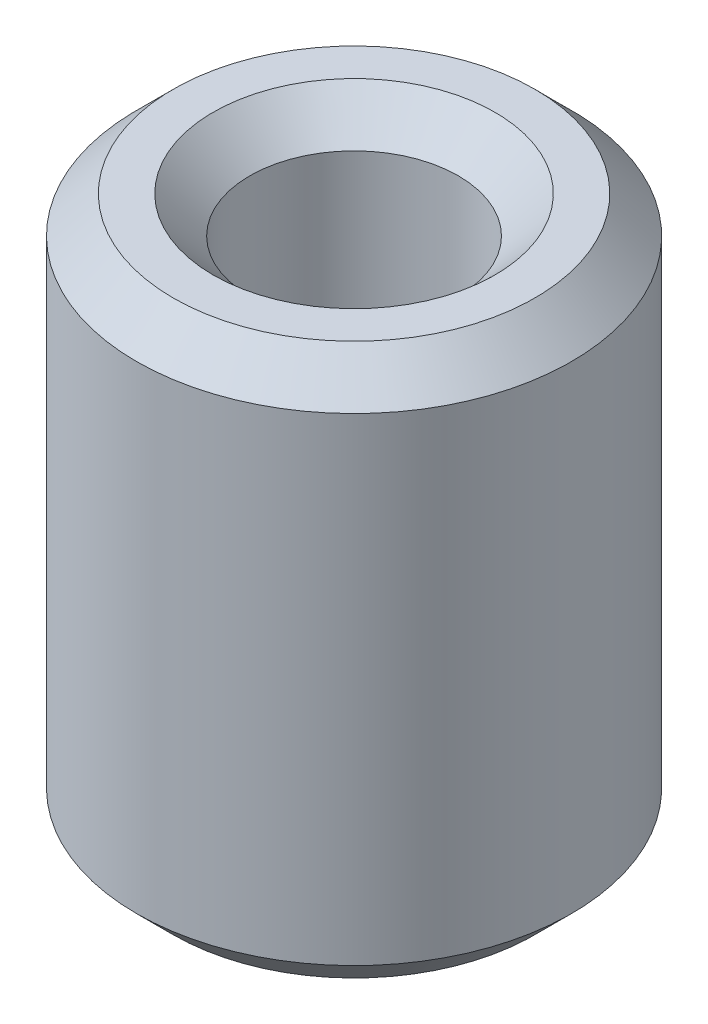
from build123d import *

# Parameters (mm, degrees)
SKETCH1_R           = 7.5
BOSS_EXTRUDE1_DEPTH = 19.01417642
SKETCH2_R           = 3.595142923
CUT_EXTRUDE1_DEPTH  = 22.77243452
CHAMFER1_SIZE       = 1.264701282


with BuildPart() as part:
    # Sketch1 → Boss-Extrude1 (new body)
    with BuildSketch(Plane(origin=(0, 0, 0), x_dir=(1, 0, 0), z_dir=(0, 1, 0))):
        Circle(SKETCH1_R)
    extrude(amount=BOSS_EXTRUDE1_DEPTH)

    # Sketch2 → Cut-Extrude1 (cut, through all)
    with BuildSketch(Plane(origin=(0, 0, 0), x_dir=(1, 0, 0), z_dir=(0, 1, 0))):
        Circle(SKETCH2_R)
    extrude(amount=CUT_EXTRUDE1_DEPTH, mode=Mode.SUBTRACT)

    # Chamfer1
    chamfer1_edges = [part.edges().sort_by_distance(p)[0] for p in [
        (-3.595142923, 19.01417642, 0),
        (-3.595142923, 0, 0),
        (-7.5, 0, 0),
        (-7.5, 19.01417642, 0),
    ]]
    chamfer(chamfer1_edges, length=CHAMFER1_SIZE)


solid = part.part
